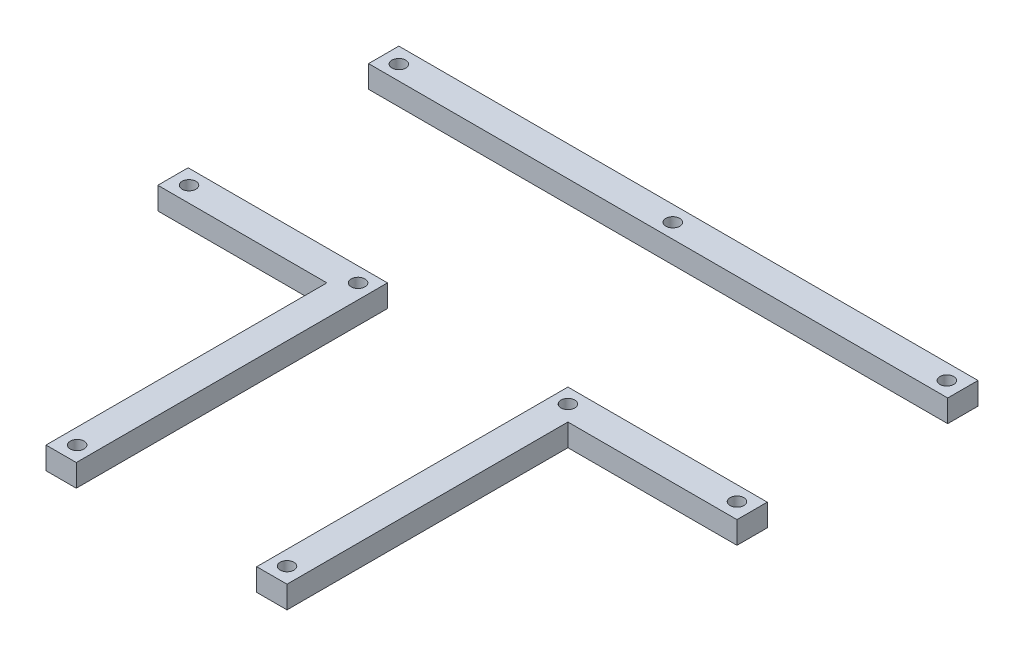
from build123d import *

# Parameters (mm, degrees)
BOSS_EXTRUDE1_DEPTH   = 5
SKETCH4_W             = 130
SKETCH4_H             = 7
BOSS_EXTRUDE1_2_DEPTH = 5
BOSS_EXTRUDE1_3_DEPTH = 5
SKETCH5_R             = 1.55
CUT_EXTRUDE1_DEPTH    = 5
MIRROR1_OUTLINE_R     = 1.55
MIRROR1_DEPTH         = 5
SKETCH6_R             = 1.55
CUT_EXTRUDE2_DEPTH    = 5
SKETCH7_W             = 130
SKETCH7_H             = 5
CUT_EXTRUDE3_DEPTH    = 0.2
SKETCH8_W             = 70.05
SKETCH8_H             = 5
CUT_EXTRUDE4_DEPTH    = 0.2
SKETCH9_W             = 44.75
SKETCH9_H             = 5
CUT_EXTRUDE5_DEPTH    = 0.2
SKETCH10_W            = 70.05
SKETCH10_H            = 5
CUT_EXTRUDE6_DEPTH    = 0.2
SKETCH11_W            = 44.75
SKETCH11_H            = 5
CUT_EXTRUDE7_DEPTH    = 0.2


# Read off the part's stored shape, not the designer's step: Mirror1
with BuildPart() as part:
    # Sketch4 → Boss-Extrude1 (new body)
    with BuildSketch(Plane(origin=(0, 0, 0), x_dir=(1, 0, 0), z_dir=(0, 1, 0))):
        Polygon((-47.47915883, -58.964084508), (-47.47915883, -65.964084508), (-9.52915883, -65.964084508), (-9.52915883, -129.014084508), (-2.52915883, -129.014084508), (-2.52915883, -58.964084508), align=None)
    extrude(amount=BOSS_EXTRUDE1_DEPTH)


with BuildPart() as body_2:
    # Sketch4 → Boss-Extrude1 2 (new body)
    with BuildSketch(Plane(origin=(0, 0, 0), x_dir=(1, 0, 0), z_dir=(0, 1, 0))):
        with Locations((17.52084117, -15.364084508)):
            Rectangle(SKETCH4_W, SKETCH4_H)
    extrude(amount=BOSS_EXTRUDE1_2_DEPTH)


with BuildPart() as body_3:
    # Sketch4 → Boss-Extrude1 3 (new body)
    with BuildSketch(Plane(origin=(0, 0, 0), x_dir=(1, 0, 0), z_dir=(0, 1, 0))):
        Polygon((37.57084117, -58.964084508), (37.57084117, -129.014084508), (44.57084117, -129.014084508), (44.57084117, -65.964084508), (82.52084117, -65.964084508), (82.52084117, -58.964084508), align=None)
    extrude(amount=BOSS_EXTRUDE1_3_DEPTH)


with BuildPart() as cut_extrude1_tool:
    # Sketch5 → Cut-Extrude1 (new body)
    with BuildSketch(Plane(origin=(0, 5, 0), x_dir=(1, 0, 0), z_dir=(0, 1, 0))):
        with Locations(Location((-6.02915883, -125.514084508, 0), (0, 0, 270))):
            Circle(SKETCH5_R)
        with Locations(Location((-6.02915883, -62.464084508, 0), (0, 0, 270))):
            Circle(SKETCH5_R)
        with Locations(Location((-43.97915883, -62.464084508, 0), (0, 0, 270))):
            Circle(SKETCH5_R)
        with Locations(Location((-43.97915883, -15.364084508, 0), (0, 0, 270))):
            Circle(SKETCH5_R)
    extrude(amount=-CUT_EXTRUDE1_DEPTH)


with BuildPart() as part_1:
    add(part.part)

    # Cut-Extrude1: cut by cut_extrude1_tool
    add(cut_extrude1_tool.part, mode=Mode.SUBTRACT)

    # Sketch8 → Cut-Extrude4 (cut)
    with BuildSketch(Plane(origin=(-2.52915883, 0, 0), x_dir=(0, 0, -1), z_dir=(1, 0, 0))):
        with Locations((-93.989084508, 2.5)):
            Rectangle(SKETCH8_W, SKETCH8_H)
    extrude(amount=-CUT_EXTRUDE4_DEPTH, mode=Mode.SUBTRACT)

    # Sketch9 → Cut-Extrude5 (cut)
    with BuildSketch(Plane(origin=(0, 0, 58.964084508), x_dir=(-1, 0, 0), z_dir=(0, 0, -1))):
        with Locations((25.10415883, 2.5)):
            Rectangle(SKETCH9_W, SKETCH9_H)
    extrude(amount=-CUT_EXTRUDE5_DEPTH, mode=Mode.SUBTRACT)


with BuildPart() as body_2_1:
    add(body_2.part)

    # Cut-Extrude1: cut by cut_extrude1_tool
    add(cut_extrude1_tool.part, mode=Mode.SUBTRACT)


with BuildPart() as mirror1_tool:
    # Mirror1 outline → Mirror1 (new body)
    with BuildSketch(Plane(origin=(0, 0, 0), x_dir=(1, 0, 0), z_dir=(0, 1, 0))):
        with Locations((41.07084117, -125.514084508)):
            Circle(MIRROR1_OUTLINE_R)
        with Locations((79.02084117, -62.464084508)):
            Circle(MIRROR1_OUTLINE_R)
        with Locations((41.07084117, -62.464084508)):
            Circle(MIRROR1_OUTLINE_R)
        with Locations((79.02084117, -15.364084508)):
            Circle(MIRROR1_OUTLINE_R)
    extrude(amount=MIRROR1_DEPTH)


with BuildPart() as body_2_2:
    add(body_2_1.part)

    # Mirror1: cut by mirror1_tool
    add(mirror1_tool.part, mode=Mode.SUBTRACT)

    # Sketch6 → Cut-Extrude2 (cut)
    with BuildSketch(Plane(origin=(0, 5, 0), x_dir=(1, 0, 0), z_dir=(0, 1, 0))):
        with Locations(Location((17.52084117, -15.364084508, 0), (0, 0, 270))):
            Circle(SKETCH6_R)
    extrude(amount=-CUT_EXTRUDE2_DEPTH, mode=Mode.SUBTRACT)

    # Sketch7 → Cut-Extrude3 (cut)
    with BuildSketch(Plane.XY.offset(18.864084508)):
        with Locations((17.52084117, 2.5)):
            Rectangle(SKETCH7_W, SKETCH7_H)
    extrude(amount=-CUT_EXTRUDE3_DEPTH, mode=Mode.SUBTRACT)


with BuildPart() as body_3_1:
    add(body_3.part)

    # Mirror1: cut by mirror1_tool
    add(mirror1_tool.part, mode=Mode.SUBTRACT)

    # Sketch10 → Cut-Extrude6 (cut)
    with BuildSketch(Plane.ZY.offset(-37.57084117)):
        with Locations((93.989084508, 2.5)):
            Rectangle(SKETCH10_W, SKETCH10_H)
    extrude(amount=-CUT_EXTRUDE6_DEPTH, mode=Mode.SUBTRACT)

    # Sketch11 → Cut-Extrude7 (cut)
    with BuildSketch(Plane(origin=(0, 0, 58.964084508), x_dir=(-1, 0, 0), z_dir=(0, 0, -1))):
        with Locations((-60.14584117, 2.5)):
            Rectangle(SKETCH11_W, SKETCH11_H)
    extrude(amount=-CUT_EXTRUDE7_DEPTH, mode=Mode.SUBTRACT)


solid = Compound([part_1.part, body_2_2.part, body_3_1.part])
